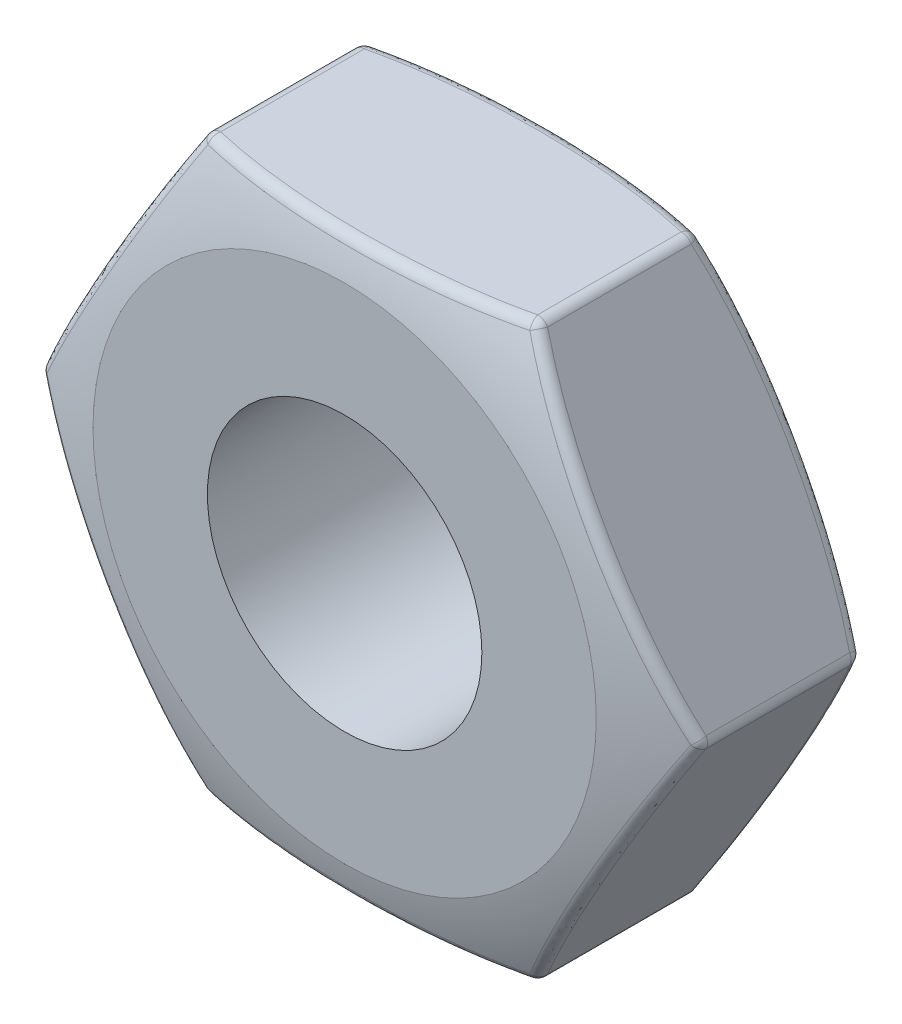
from build123d import *

# Parameters (mm, degrees)
EXTRUDE1_DEPTH     = 1.86
SKETCH3_R          = 1.2
CUT_EXTRUDE1_DEPTH = 12.5
FILLET1_R          = 0.1
FILLET2_R          = 0.1


with BuildPart() as part:
    # Sketch1 → Extrude1 (new body)
    with BuildSketch(Plane.XY):
        Polygon((2.886751346, 0), (1.443375673, 2.5), (-1.443375673, 2.5), (-2.886751346, 0), (-1.443375673, -2.5), (1.443375673, -2.5), align=None)
    extrude(amount=EXTRUDE1_DEPTH)

    # Sketch2 → Cut-Revolve1 (revolve, cut)
    with BuildSketch(Plane(origin=(0, 0, 0), x_dir=(0, 0, -1), z_dir=(1, 0, 0))):
        with BuildLine():
            Line((-0.5, 3.3), (0.473267316, 3.3))
            Line((0.473267316, 3.3), (0.473267316, 2.2))
            Line((0.473267316, 2.2), (0, 2.2))
            ThreePointArc((0, 2.2), (-0.194046192, 2.775433549), (-0.5, 3.3))
        make_face()
        with BuildLine():
            Line((-1.36, 3.3), (-2.836315201, 3.3))
            Line((-2.836315201, 3.3), (-2.836315201, 2.2))
            Line((-2.836315201, 2.2), (-1.86, 2.2))
            ThreePointArc((-1.86, 2.2), (-1.665953808, 2.775433549), (-1.36, 3.3))
        make_face()
    revolve(axis=Axis((0, 0, -1.011768521), (0, 0, 1)), mode=Mode.SUBTRACT)

    # Sketch3 → Cut-Extrude1 (cut)
    with BuildSketch(Plane.XY.offset(1.86)):
        Circle(SKETCH3_R)
    extrude(amount=-CUT_EXTRUDE1_DEPTH, mode=Mode.SUBTRACT)

    # Fillet1
    fillet1_edges = [part.edges().sort_by_distance(p)[0] for p in [
        (-1.443375673, 2.5, 0.93),
        (-2.886751346, 0, 0.93),
        (-1.443375673, -2.5, 0.93),
        (1.443375673, -2.5, 0.93),
        (2.886751346, 0, 0.93),
        (1.443375673, 2.5, 0.93),
    ]]
    fillet(fillet1_edges, radius=FILLET1_R)

    # Fillet2
    fillet2_edges = [part.edges().sort_by_distance(p)[0] for p in [
        (-2.871281292, 0, 0.239676419),
        (-1.435640646, 2.48660254, 0.239676419),
        (1.435640646, 2.48660254, 0.239676419),
        (2.871281292, 0, 0.239676419),
        (1.435640646, -2.48660254, 0.239676419),
        (-1.435640646, -2.48660254, 0.239676419),
        (-1.435640646, -2.48660254, 1.620323581),
        (1.435640646, -2.48660254, 1.620323581),
        (2.871281292, 0, 1.620323581),
        (1.435640646, 2.48660254, 1.620323581),
        (-1.435640646, 2.48660254, 1.620323581),
        (-2.871281292, 0, 1.620323581),
        (2.16506351, 1.25, 1.775081788),
        (2.16506351, 1.25, 0.084918212),
        (2.165063509, -1.25, 0.084918212),
        (0, -2.2, 0),
        (2.165063509, -1.25, 1.775081788),
        (0, -2.2, 1.86),
        (0, -2.2, 1.86),
        (-2.165063509, 1.25, 1.775081788),
        (0, -2.2, 0),
        (-2.165063509, 1.25, 0.084918212),
        (-2.16506351, -1.25, 0.084918212),
        (-2.16506351, -1.25, 1.775081788),
    ]]
    fillet(fillet2_edges, radius=FILLET2_R)


solid = part.part
